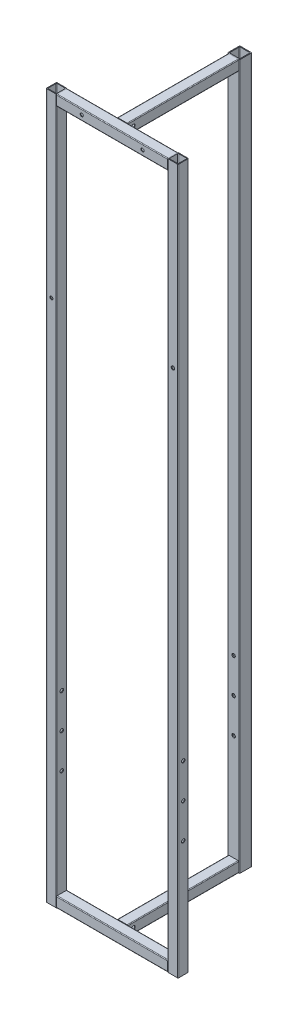
from build123d import *

# Parameters (mm, degrees)
CUSTOM_TUBE_CARRE_30_2_1_DEPTH      = 2015
CUSTOM_TUBE_CARRE_30_2_1_DEPTH_BACK = 15
CUSTOM_TUBE_CARRE_30_2_1_2_DEPTH    = 2030
CUSTOM_TUBE_CARRE_30_2_1_3_DEPTH    = 352
CUSTOM_TUBE_CARRE_30_2_1_4_DEPTH    = 352
CUSTOM_TUBE_CARRE_30_2_2_DEPTH      = 352.5
CUSTOM_TUBE_CARRE_30_2_2_2_DEPTH    = 352.5
CUSTOM_TUBE_CARRE_35_2_5_1_DEPTH    = 2000
BODY_START                          = 98.994949366
BODY_7_RUN_ON_DEPTH                 = 113.994949366
BODY_START_2                        = 1901.005050634
BODY_7_RUN_ON_2_DEPTH               = 113.994949366
ESQUISSE13_W                        = 4.5
ESQUISSE13_H                        = 415
D_GAGEMENT_M81_AT_2_COUNT           = 2
D_GAGEMENT_M81_AT_2_PITCH           = 175
D_GAGEMENT_START                    = -15
D_GAGEMENT_M82_OUTLINE_R            = 4.5
D_GAGEMENT_M82_DEPTH                = 30
ESQUISSE17_W                        = 5
ESQUISSE17_H                        = 380
D_GAGEMENT_M83_AT_2_COUNT           = 2
D_GAGEMENT_M83_AT_2_PITCH           = 100
D_GAGEMENT_M83_AT_3_COUNT           = 2
D_GAGEMENT_M83_AT_3_PITCH           = 200
ESQUISSE21_W                        = 5
ESQUISSE21_H                        = 208
D_GAGEMENT_M85_AT_2_COUNT           = 2
D_GAGEMENT_M85_AT_2_PITCH           = 2000
D_GAGEMENT_M88_AT_2_COUNT           = 2
D_GAGEMENT_M88_AT_2_PITCH           = 100
D_GAGEMENT_M88_AT_3_COUNT           = 2
D_GAGEMENT_M88_AT_3_PITCH           = 200


# Read off the part's stored shape, not the designer's step: Dégagement M82
with BuildPart() as part:
    # Esquisse1 → Custom TUBE-CARRE-30-2(1) (new, two sides: drawn at the far end of the back side and taken through both)
    with BuildSketch(Plane(origin=(175, -1000, 0), x_dir=(-1, 0, 0), z_dir=(0, 1, 0)).offset(-CUSTOM_TUBE_CARRE_30_2_1_DEPTH_BACK)):
        with BuildLine():
            Line((-13, -15), (13, -15))
            ThreePointArc((13, -15), (14.414213562, -14.414213562), (15, -13))
            Line((15, -13), (15, 13))
            ThreePointArc((15, 13), (14.414213562, 14.414213562), (13, 15))
            Line((13, 15), (-13, 15))
            ThreePointArc((-13, 15), (-14.414213562, 14.414213562), (-15, 13))
            Line((-15, 13), (-15, -13))
            ThreePointArc((-15, -13), (-14.414213562, -14.414213562), (-13, -15))
        make_face()
        with BuildLine():
            Line((-11, -13), (11, -13))
            ThreePointArc((11, -13), (12.414213562, -12.414213562), (13, -11))
            Line((13, -11), (13, 11))
            ThreePointArc((13, 11), (12.414213562, 12.414213562), (11, 13))
            Line((11, 13), (-11, 13))
            ThreePointArc((-11, 13), (-12.414213562, 12.414213562), (-13, 11))
            Line((-13, 11), (-13, -11))
            ThreePointArc((-13, -11), (-12.414213562, -12.414213562), (-11, -13))
        make_face(mode=Mode.SUBTRACT)
    extrude(amount=CUSTOM_TUBE_CARRE_30_2_1_DEPTH + CUSTOM_TUBE_CARRE_30_2_1_DEPTH_BACK)


with BuildPart() as body_2:
    # Esquisse1 on segment 2 (carried to segment 2) → Custom TUBE-CARRE-30-2_1 2 (new body)
    with BuildSketch(Plane(origin=(-175, -1015, 0), x_dir=(-1, 0, 0), z_dir=(0, 1, 0))):
        with BuildLine():
            Line((-13, -15), (13, -15))
            ThreePointArc((13, -15), (14.414213562, -14.414213562), (15, -13))
            Line((15, -13), (15, 13))
            ThreePointArc((15, 13), (14.414213562, 14.414213562), (13, 15))
            Line((13, 15), (-13, 15))
            ThreePointArc((-13, 15), (-14.414213562, 14.414213562), (-15, 13))
            Line((-15, 13), (-15, -13))
            ThreePointArc((-15, -13), (-14.414213562, -14.414213562), (-13, -15))
        make_face()
        with BuildLine():
            Line((-11, -13), (11, -13))
            ThreePointArc((11, -13), (12.414213562, -12.414213562), (13, -11))
            Line((13, -11), (13, 11))
            ThreePointArc((13, 11), (12.414213562, 12.414213562), (11, 13))
            Line((11, 13), (-11, 13))
            ThreePointArc((-11, 13), (-12.414213562, 12.414213562), (-13, 11))
            Line((-13, 11), (-13, -11))
            ThreePointArc((-13, -11), (-12.414213562, -12.414213562), (-11, -13))
        make_face(mode=Mode.SUBTRACT)
    extrude(amount=CUSTOM_TUBE_CARRE_30_2_1_2_DEPTH)


with BuildPart() as body_3:
    # Esquisse1 on segment 3 (carried to segment 3) → Custom TUBE-CARRE-30-2_1 3 (new body)
    with BuildSketch(Plane(origin=(-176, 1000, 0), x_dir=(0, 1, 0), z_dir=(1, 0, 0))):
        with BuildLine():
            Line((-13, -15), (13, -15))
            ThreePointArc((13, -15), (14.414213562, -14.414213562), (15, -13))
            Line((15, -13), (15, 13))
            ThreePointArc((15, 13), (14.414213562, 14.414213562), (13, 15))
            Line((13, 15), (-13, 15))
            ThreePointArc((-13, 15), (-14.414213562, 14.414213562), (-15, 13))
            Line((-15, 13), (-15, -13))
            ThreePointArc((-15, -13), (-14.414213562, -14.414213562), (-13, -15))
        make_face()
        with BuildLine():
            Line((-11, -13), (11, -13))
            ThreePointArc((11, -13), (12.414213562, -12.414213562), (13, -11))
            Line((13, -11), (13, 11))
            ThreePointArc((13, 11), (12.414213562, 12.414213562), (11, 13))
            Line((11, 13), (-11, 13))
            ThreePointArc((-11, 13), (-12.414213562, 12.414213562), (-13, 11))
            Line((-13, 11), (-13, -11))
            ThreePointArc((-13, -11), (-12.414213562, -12.414213562), (-11, -13))
        make_face(mode=Mode.SUBTRACT)
    extrude(amount=CUSTOM_TUBE_CARRE_30_2_1_3_DEPTH)

    # Custom TUBE-CARRE-30-2_1 3 end butt 1
    split(bisect_by=Plane(origin=(-160, 1000, 0), x_dir=(0, 1, 0), z_dir=(1, 0, 0)), keep=Keep.TOP)

    # Custom TUBE-CARRE-30-2_1 3 end butt 2
    split(bisect_by=Plane(origin=(160, 1000, 0), x_dir=(0, -1, 0), z_dir=(-1, 0, 0)), keep=Keep.TOP)

    # Esquisse13 → Dégagement M81 (revolve, cut)
    with BuildSketch(Plane(origin=(87.5, 1000, 45), x_dir=(0, -1, 0), z_dir=(1, 0, 0))):
        with Locations((2.25, 207.5)):
            Rectangle(ESQUISSE13_W, ESQUISSE13_H)
    d_gagement_m81 = revolve(axis=Axis((87.5, 1000, 51.35), (0, 0, -1)), mode=Mode.SUBTRACT)

    # Dégagement M81 at 2: Dégagement M81 ×2
    with Locations(*[(-i * D_GAGEMENT_M81_AT_2_PITCH, 0, 0) for i in range(1, D_GAGEMENT_M81_AT_2_COUNT)]):
        add(d_gagement_m81, mode=Mode.SUBTRACT)


with BuildPart() as body_4:
    # Esquisse1 on segment 4 (carried to segment 4) → Custom TUBE-CARRE-30-2_1 4 (new body)
    with BuildSketch(Plane(origin=(-176, -1000, 0), x_dir=(0, 1, 0), z_dir=(1, 0, 0))):
        with BuildLine():
            Line((-13, -15), (13, -15))
            ThreePointArc((13, -15), (14.414213562, -14.414213562), (15, -13))
            Line((15, -13), (15, 13))
            ThreePointArc((15, 13), (14.414213562, 14.414213562), (13, 15))
            Line((13, 15), (-13, 15))
            ThreePointArc((-13, 15), (-14.414213562, 14.414213562), (-15, 13))
            Line((-15, 13), (-15, -13))
            ThreePointArc((-15, -13), (-14.414213562, -14.414213562), (-13, -15))
        make_face()
        with BuildLine():
            Line((-11, -13), (11, -13))
            ThreePointArc((11, -13), (12.414213562, -12.414213562), (13, -11))
            Line((13, -11), (13, 11))
            ThreePointArc((13, 11), (12.414213562, 12.414213562), (11, 13))
            Line((11, 13), (-11, 13))
            ThreePointArc((-11, 13), (-12.414213562, 12.414213562), (-13, 11))
            Line((-13, 11), (-13, -11))
            ThreePointArc((-13, -11), (-12.414213562, -12.414213562), (-11, -13))
        make_face(mode=Mode.SUBTRACT)
    extrude(amount=CUSTOM_TUBE_CARRE_30_2_1_4_DEPTH)

    # Custom TUBE-CARRE-30-2_1 4 end butt 1
    split(bisect_by=Plane(origin=(-160, -1000, 0), x_dir=(0, 1, 0), z_dir=(1, 0, 0)), keep=Keep.TOP)

    # Custom TUBE-CARRE-30-2_1 4 end butt 2
    split(bisect_by=Plane(origin=(160, -1000, 0), x_dir=(0, -1, 0), z_dir=(-1, 0, 0)), keep=Keep.TOP)


with BuildPart() as body_5:
    # Esquisse11 → Custom TUBE-CARRE-30-2(2) (new body)
    with BuildSketch(Plane(origin=(0, 1000, 0), x_dir=(0, 1, 0), z_dir=(0, 0, -1))):
        with BuildLine():
            Line((-13, -15), (13, -15))
            ThreePointArc((13, -15), (14.414213562, -14.414213562), (15, -13))
            Line((15, -13), (15, 13))
            ThreePointArc((15, 13), (14.414213562, 14.414213562), (13, 15))
            Line((13, 15), (-13, 15))
            ThreePointArc((-13, 15), (-14.414213562, 14.414213562), (-15, 13))
            Line((-15, 13), (-15, -13))
            ThreePointArc((-15, -13), (-14.414213562, -14.414213562), (-13, -15))
        make_face()
        with BuildLine():
            Line((-11, -13), (11, -13))
            ThreePointArc((11, -13), (12.414213562, -12.414213562), (13, -11))
            Line((13, -11), (13, 11))
            ThreePointArc((13, 11), (12.414213562, 12.414213562), (11, 13))
            Line((11, 13), (-11, 13))
            ThreePointArc((-11, 13), (-12.414213562, 12.414213562), (-13, 11))
            Line((-13, 11), (-13, -11))
            ThreePointArc((-13, -11), (-12.414213562, -12.414213562), (-11, -13))
        make_face(mode=Mode.SUBTRACT)
    extrude(amount=CUSTOM_TUBE_CARRE_30_2_2_DEPTH)

    # Ajuster/Prolonger1
    split(bisect_by=Plane(origin=(0, 1000, -15), x_dir=(0, 1, 0), z_dir=(0, 0, -1)), keep=Keep.TOP)

    # Ajuster_Prolonger3 7
    split(bisect_by=Plane(origin=(0, 0, -335), x_dir=(0, -1, 0), z_dir=(0, 0, 1)), keep=Keep.TOP)


with BuildPart() as body_6:
    # Esquisse11 on segment 2 (carried to segment 2) → Custom TUBE-CARRE-30-2_2 2 (new body)
    with BuildSketch(Plane(origin=(0, -1000, 0), x_dir=(0, 1, 0), z_dir=(0, 0, -1))):
        with BuildLine():
            Line((-13, -15), (13, -15))
            ThreePointArc((13, -15), (14.414213562, -14.414213562), (15, -13))
            Line((15, -13), (15, 13))
            ThreePointArc((15, 13), (14.414213562, 14.414213562), (13, 15))
            Line((13, 15), (-13, 15))
            ThreePointArc((-13, 15), (-14.414213562, 14.414213562), (-15, 13))
            Line((-15, 13), (-15, -13))
            ThreePointArc((-15, -13), (-14.414213562, -14.414213562), (-13, -15))
        make_face()
        with BuildLine():
            Line((-11, -13), (11, -13))
            ThreePointArc((11, -13), (12.414213562, -12.414213562), (13, -11))
            Line((13, -11), (13, 11))
            ThreePointArc((13, 11), (12.414213562, 12.414213562), (11, 13))
            Line((11, 13), (-11, 13))
            ThreePointArc((-11, 13), (-12.414213562, 12.414213562), (-13, 11))
            Line((-13, 11), (-13, -11))
            ThreePointArc((-13, -11), (-12.414213562, -12.414213562), (-11, -13))
        make_face(mode=Mode.SUBTRACT)
    extrude(amount=CUSTOM_TUBE_CARRE_30_2_2_2_DEPTH)

    # Ajuster/Prolonger2
    split(bisect_by=Plane(origin=(0, -1000, -15), x_dir=(0, 1, 0), z_dir=(0, 0, -1)), keep=Keep.TOP)

    # Ajuster_Prolonger4 5
    split(bisect_by=Plane(origin=(0, 7.5, -335), x_dir=(0, -1, 0), z_dir=(0, 0, 1)), keep=Keep.TOP)

    # Esquisse21 → Dégagement M85 (revolve, cut)
    with BuildSketch(Plane(origin=(-18, -1000, -31.5), x_dir=(0, 0, 1), z_dir=(0, 1, 0))):
        with Locations((2.5, 104)):
            Rectangle(ESQUISSE21_W, ESQUISSE21_H)
    d_gagement_m85 = revolve(axis=Axis((-24.35, -1000, -31.5), (1, 0, 0)), mode=Mode.SUBTRACT)


with BuildPart() as body_7:
    # Esquisse112 → Custom TUBE-CARRE-35-2.5(1) (new body)
    with BuildSketch(Plane(origin=(0, 1000, -352.5), x_dir=(0, 0, -1), z_dir=(0, -1, 0))):
        with BuildLine():
            Line((-15.5, -17.5), (15.5, -17.5))
            ThreePointArc((15.5, -17.5), (16.914213562, -16.914213562), (17.5, -15.5))
            Line((17.5, -15.5), (17.5, 15.5))
            ThreePointArc((17.5, 15.5), (16.914213562, 16.914213562), (15.5, 17.5))
            Line((15.5, 17.5), (-15.5, 17.5))
            ThreePointArc((-15.5, 17.5), (-16.914213562, 16.914213562), (-17.5, 15.5))
            Line((-17.5, 15.5), (-17.5, -15.5))
            ThreePointArc((-17.5, -15.5), (-16.914213562, -16.914213562), (-15.5, -17.5))
        make_face()
        with BuildLine():
            Line((-13, -15), (13, -15))
            ThreePointArc((13, -15), (14.414213562, -14.414213562), (15, -13))
            Line((15, -13), (15, 13))
            ThreePointArc((15, 13), (14.414213562, 14.414213562), (13, 15))
            Line((13, 15), (-13, 15))
            ThreePointArc((-13, 15), (-14.414213562, 14.414213562), (-15, 13))
            Line((-15, 13), (-15, -13))
            ThreePointArc((-15, -13), (-14.414213562, -14.414213562), (-13, -15))
        make_face(mode=Mode.SUBTRACT)
    extrude(amount=CUSTOM_TUBE_CARRE_35_2_5_1_DEPTH)

    # body 7 cut square before the run-on
    split(bisect_by=Plane(origin=(0, 901.005050634, -352.5), x_dir=(1, 0, 0), z_dir=(0, -1, 0)), keep=Keep.TOP)

    # Esquisse112 → body 7 run on (add)
    with BuildSketch(Plane(origin=(0, 1000, -352.5), x_dir=(0, 0, -1), z_dir=(0, -1, 0)).offset(BODY_START)):
        with BuildLine():
            Line((-15.5, -17.5), (15.5, -17.5))
            ThreePointArc((15.5, -17.5), (16.914213562, -16.914213562), (17.5, -15.5))
            Line((17.5, -15.5), (17.5, 15.5))
            ThreePointArc((17.5, 15.5), (16.914213562, 16.914213562), (15.5, 17.5))
            Line((15.5, 17.5), (-15.5, 17.5))
            ThreePointArc((-15.5, 17.5), (-16.914213562, 16.914213562), (-17.5, 15.5))
            Line((-17.5, 15.5), (-17.5, -15.5))
            ThreePointArc((-17.5, -15.5), (-16.914213562, -16.914213562), (-15.5, -17.5))
        make_face()
        with BuildLine():
            Line((-13, -15), (13, -15))
            ThreePointArc((13, -15), (14.414213562, -14.414213562), (15, -13))
            Line((15, -13), (15, 13))
            ThreePointArc((15, 13), (14.414213562, 14.414213562), (13, 15))
            Line((13, 15), (-13, 15))
            ThreePointArc((-13, 15), (-14.414213562, 14.414213562), (-15, 13))
            Line((-15, 13), (-15, -13))
            ThreePointArc((-15, -13), (-14.414213562, -14.414213562), (-13, -15))
        make_face(mode=Mode.SUBTRACT)
    extrude(amount=-BODY_7_RUN_ON_DEPTH)

    # body 7 cut square before the run-on
    split(bisect_by=Plane(origin=(0, -901.005050634, -352.5), x_dir=(-1, 0, 0), z_dir=(0, 1, 0)), keep=Keep.TOP)

    # Esquisse112 → body 7 run on 2 (add)
    with BuildSketch(Plane(origin=(0, 1000, -352.5), x_dir=(0, 0, -1), z_dir=(0, -1, 0)).offset(BODY_START_2)):
        with BuildLine():
            Line((-15.5, -17.5), (15.5, -17.5))
            ThreePointArc((15.5, -17.5), (16.914213562, -16.914213562), (17.5, -15.5))
            Line((17.5, -15.5), (17.5, 15.5))
            ThreePointArc((17.5, 15.5), (16.914213562, 16.914213562), (15.5, 17.5))
            Line((15.5, 17.5), (-15.5, 17.5))
            ThreePointArc((-15.5, 17.5), (-16.914213562, 16.914213562), (-17.5, 15.5))
            Line((-17.5, 15.5), (-17.5, -15.5))
            ThreePointArc((-17.5, -15.5), (-16.914213562, -16.914213562), (-15.5, -17.5))
        make_face()
        with BuildLine():
            Line((-13, -15), (13, -15))
            ThreePointArc((13, -15), (14.414213562, -14.414213562), (15, -13))
            Line((15, -13), (15, 13))
            ThreePointArc((15, 13), (14.414213562, 14.414213562), (13, 15))
            Line((13, 15), (-13, 15))
            ThreePointArc((-13, 15), (-14.414213562, 14.414213562), (-15, 13))
            Line((-15, 13), (-15, -13))
            ThreePointArc((-15, -13), (-14.414213562, -14.414213562), (-13, -15))
        make_face(mode=Mode.SUBTRACT)
    extrude(amount=BODY_7_RUN_ON_2_DEPTH)

    # Esquisse116 → Dégagement M88 (revolve, cut)
    with BuildSketch(Plane(origin=(0, -680, -370), x_dir=(0, 1, 0), z_dir=(1, 0, 0))):
        Polygon((0, 0), (0, 225.504303095), (5, 222.5), (5, 0), align=None)
    d_gagement_m88 = revolve(axis=Axis((0, -680, -376.35), (0, 0, 1)), mode=Mode.SUBTRACT)

    # Dégagement M88 at 2: Dégagement M88 ×2
    with Locations(*[(0, i * D_GAGEMENT_M88_AT_2_PITCH, 0) for i in range(1, D_GAGEMENT_M88_AT_2_COUNT)]):
        add(d_gagement_m88, mode=Mode.SUBTRACT)

    # Dégagement M88 at 3: Dégagement M88 ×2
    with Locations(*[(0, i * D_GAGEMENT_M88_AT_3_PITCH, 0) for i in range(1, D_GAGEMENT_M88_AT_3_COUNT)]):
        add(d_gagement_m88, mode=Mode.SUBTRACT)


with BuildPart() as d_gagement_m82_tool:
    # Dégagement M82 outline → Dégagement M82 (new body)
    with BuildSketch(Plane.XY.offset(D_GAGEMENT_START)):
        with Locations((175, 500)):
            Circle(D_GAGEMENT_M82_OUTLINE_R)
        with Locations((-175, 500)):
            Circle(D_GAGEMENT_M82_OUTLINE_R)
    extrude(amount=D_GAGEMENT_M82_DEPTH)


with BuildPart() as part_1:
    add(part.part)

    # Dégagement M82: cut by d_gagement_m82_tool
    add(d_gagement_m82_tool.part, mode=Mode.SUBTRACT)


with BuildPart() as body_2_1:
    add(body_2.part)

    # Dégagement M82: cut by d_gagement_m82_tool
    add(d_gagement_m82_tool.part, mode=Mode.SUBTRACT)


with BuildPart() as d_gagement_m83_tool:
    # Esquisse17 → Dégagement M83 (revolve)
    with BuildSketch(Plane(origin=(190, -680, 0), x_dir=(0, 0, -1), z_dir=(0, 1, 0))):
        with Locations((2.5, 190)):
            Rectangle(ESQUISSE17_W, ESQUISSE17_H)
    d_gagement_m83 = revolve(axis=Axis((196.35, -680, 0), (-1, 0, 0)))


with BuildPart() as part_2:
    add(part_1.part)

    # Dégagement M83: cut by d_gagement_m83_tool
    add(d_gagement_m83_tool.part, mode=Mode.SUBTRACT)


with BuildPart() as body_2_2:
    add(body_2_1.part)

    # Dégagement M83: cut by d_gagement_m83_tool
    add(d_gagement_m83_tool.part, mode=Mode.SUBTRACT)


with BuildPart() as d_gagement_m83_at_2_tool:
    # Dégagement M83 at 2: Dégagement M83 ×2
    with Locations(*[(0, i * D_GAGEMENT_M83_AT_2_PITCH, 0) for i in range(1, D_GAGEMENT_M83_AT_2_COUNT)]):
        add(d_gagement_m83)


with BuildPart() as part_3:
    add(part_2.part)

    # Dégagement M83 at 2: cut by d_gagement_m83_at_2_tool
    add(d_gagement_m83_at_2_tool.part, mode=Mode.SUBTRACT)


with BuildPart() as body_2_3:
    add(body_2_2.part)

    # Dégagement M83 at 2: cut by d_gagement_m83_at_2_tool
    add(d_gagement_m83_at_2_tool.part, mode=Mode.SUBTRACT)


with BuildPart() as d_gagement_m83_at_3_tool:
    # Dégagement M83 at 3: Dégagement M83 ×2
    with Locations(*[(0, i * D_GAGEMENT_M83_AT_3_PITCH, 0) for i in range(1, D_GAGEMENT_M83_AT_3_COUNT)]):
        add(d_gagement_m83)


with BuildPart() as part_4:
    add(part_3.part)

    # Dégagement M83 at 3: cut by d_gagement_m83_at_3_tool
    add(d_gagement_m83_at_3_tool.part, mode=Mode.SUBTRACT)

    # Esquisse23 → Dégagement M86 (revolve, cut)
    with BuildSketch(Plane(origin=(175, 500, -15), x_dir=(0, 1, 0), z_dir=(1, 0, 0))):
        Polygon((0, 0), (0, 503.004303095), (5, 500), (5, 0), align=None)
    revolve(axis=Axis((175, 500, -21.35), (0, 0, 1)), mode=Mode.SUBTRACT)


with BuildPart() as body_2_4:
    add(body_2_3.part)

    # Dégagement M83 at 3: cut by d_gagement_m83_at_3_tool
    add(d_gagement_m83_at_3_tool.part, mode=Mode.SUBTRACT)


with BuildPart() as body_5_1:
    add(body_5.part)

    # Dégagement M85 at 2: Dégagement M85 ×2
    with Locations(*[(0, i * D_GAGEMENT_M85_AT_2_PITCH, 0) for i in range(1, D_GAGEMENT_M85_AT_2_COUNT)]):
        add(d_gagement_m85, mode=Mode.SUBTRACT)


solid = Compound([body_3.part, body_4.part, body_6.part, body_7.part, part_4.part, body_2_4.part, body_5_1.part])
